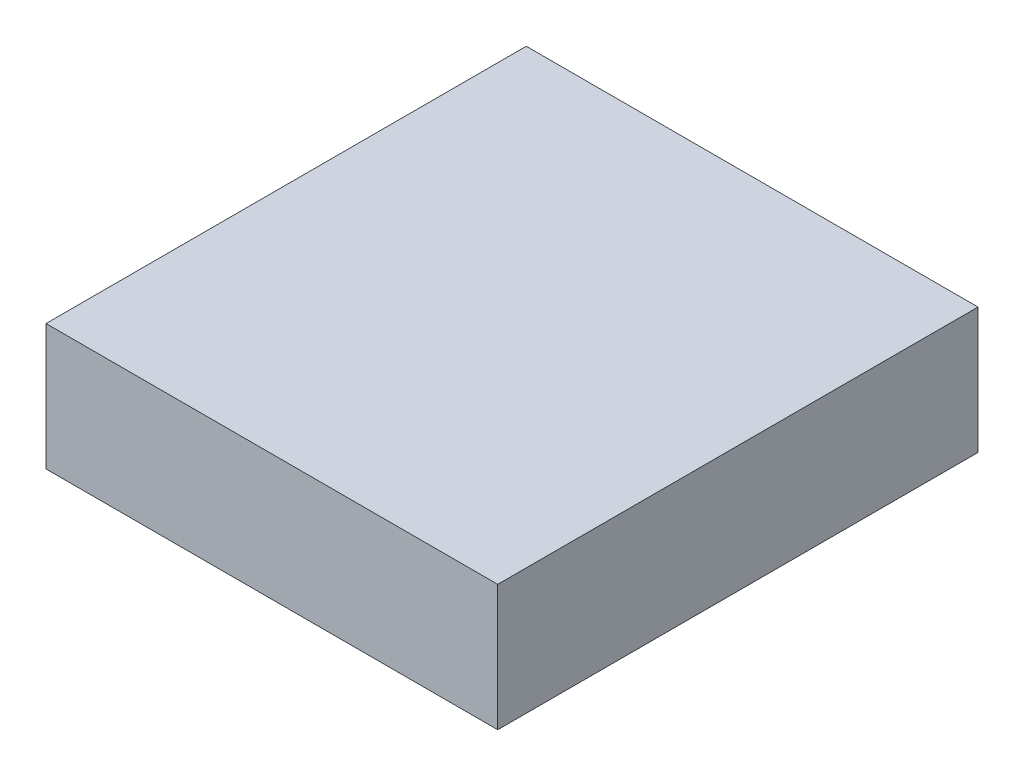
from build123d import *

# Parameters (mm, degrees)
SKETCH1_W           = 107.6
SKETCH1_H           = 114.4
BOSS_EXTRUDE1_DEPTH = 30


with BuildPart() as part:
    # Sketch1 → Boss-Extrude1 (new body)
    with BuildSketch(Plane(origin=(0, 0, 0), x_dir=(1, 0, 0), z_dir=(0, 1, 0))):
        with Locations((53.8, 57.2)):
            Rectangle(SKETCH1_W, SKETCH1_H)
    extrude(amount=BOSS_EXTRUDE1_DEPTH)


solid = part.part
